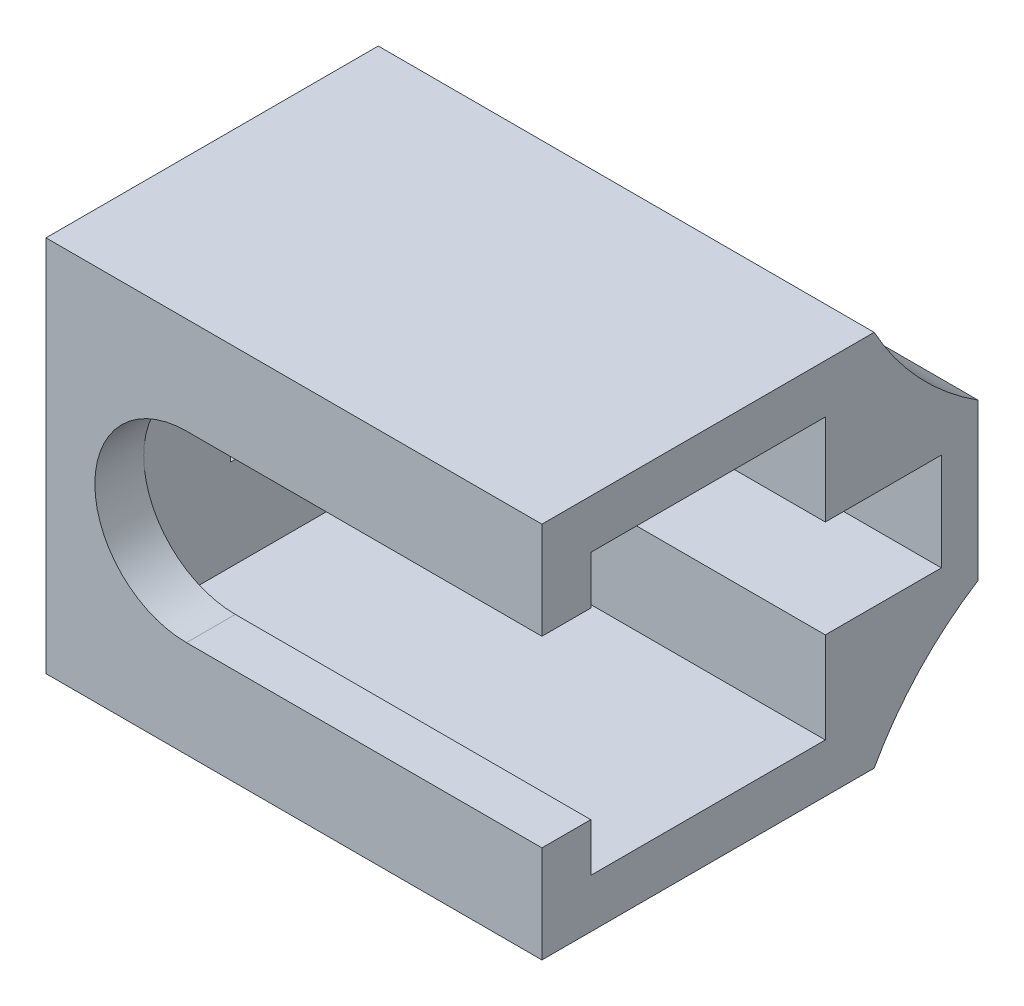
from build123d import *

# Parameters (mm, degrees)
SKETCH1_W               = 115
SKETCH1_H               = 90
BOSS_EXTRUDE1_DEPTH     = 2.5
SKETCH2_W               = 27.2
SKETCH2_H               = 30.9
SKETCH2_W_2             = 19.2
SKETCH2_H_2             = 22.9
BOSS_EXTRUDE2_DEPTH     = 40.6
SKETCH3_W               = 19.2
SKETCH3_H               = 22.9
BOSS_EXTRUDE3_DEPTH     = 4
CUT_EXTRUDE1_REACH      = 136.592
SKETCH4_W               = 5
SKETCH4_H               = 8
FILLET1_R               = 25
SKETCH5_W               = 38.2
SKETCH5_H               = 8
CUT_EXTRUDE2_DEPTH      = 39.6
CUT_EXTRUDE3_REACH      = 92.993
SKETCH6_W               = 20
SKETCH6_H               = 9.5
CUT_EXTRUDE4_REACH      = 129.903
CUT_EXTRUDE5_DEPTH      = 135.591762378
CUT_EXTRUDE5_DEPTH_BACK = 135.591762378
SKETCH9_W               = 100.7
SKETCH9_H               = 30.9
CUT_EXTRUDE6_REACH      = 92.993


# Read off the part's stored shape, not the designer's step: Mirror1
with BuildPart() as part:
    # Sketch1 → Boss-Extrude1 (new, symmetric)
    with BuildSketch(Plane(origin=(0, 0, 0), x_dir=(1, 0, 0), z_dir=(0, 1, 0))):
        Rectangle(SKETCH1_W, SKETCH1_H)
    extrude(amount=BOSS_EXTRUDE1_DEPTH, both=True)

    # Sketch2 → Boss-Extrude2 (add)
    with BuildSketch(Plane.ZY.offset(57.5)):
        with Locations((54.6, 0)):
            Rectangle(SKETCH2_W, SKETCH2_H)
        with Locations((54.6, 0)):
            Rectangle(SKETCH2_W_2, SKETCH2_H_2, mode=Mode.SUBTRACT)
    extrude(amount=-BOSS_EXTRUDE2_DEPTH)

    # Sketch3 → Boss-Extrude3 (add)
    with BuildSketch(Plane.ZY.offset(57.5)):
        with Locations((54.6, 0)):
            Rectangle(SKETCH3_W, SKETCH3_H)
    extrude(amount=-BOSS_EXTRUDE3_DEPTH)

    # Sketch4 → Cut-Extrude1 (cut, up to next)
    with BuildSketch(Plane.ZY.offset(57.5), mode=Mode.PRIVATE) as cut_extrude1_sk1:
        with Locations((54.6, 0)):
            Rectangle(SKETCH4_W, SKETCH4_H)
    cut_extrude1_tool1 = extrude(cut_extrude1_sk1.sketch, amount=-CUT_EXTRUDE1_REACH, mode=Mode.PRIVATE) & part.part
    add(cut_extrude1_tool1.solids().sort_by_distance((-57.5, 0, 54.6))[0], mode=Mode.SUBTRACT)

    # Fillet1
    # the kernel refuses this fillet: 25 mm, written as the material it adds along each edge
    with BuildSketch(Plane(origin=(-57.5, -2.5, 41), x_dir=(0, 0, -1), z_dir=(1, 0, 0))) as fillet1_piece_1:
        with BuildLine():
            CenterArc((21.904280404, -25), FILLET1_R, 90, 61.183893167)
            Line((0, -12.95), (-0.438085608, -12.709))
            ThreePointArc((-0.438085608, -12.709), (-0.5, -6.475), (-0.5, 0))
            Line((-0.5, 0), (0, 0.5))
            Line((0, 0.5), (21.904280404, 0.5))
            Line((21.904280404, 0.5), (21.904280404, 0))
        make_face()
    extrude(amount=40.6)
    with BuildSketch(Plane(origin=(-57.5, 2.5, 41), x_dir=(0, 0, -1), z_dir=(1, 0, 0))) as fillet1_piece_2:
        with BuildLine():
            CenterArc((21.904280404, 25), FILLET1_R, 208.816106833, 61.183893167)
            Line((0, 12.95), (-0.438085608, 12.709))
            ThreePointArc((-0.438085608, 12.709), (-0.5, 6.475), (-0.5, 0))
            Line((-0.5, 0), (0, -0.5))
            Line((0, -0.5), (21.904280404, -0.5))
            Line((21.904280404, -0.5), (21.904280404, 0))
        make_face()
    extrude(amount=40.6)

    # Sketch5 → Cut-Extrude2 (cut)
    with BuildSketch(Plane(origin=(-8.9, 0, 0), x_dir=(0, 0, -1), z_dir=(1, 0, 0))):
        with Locations((-54.6, 0)):
            Rectangle(SKETCH5_W, SKETCH5_H)
    extrude(amount=-CUT_EXTRUDE2_DEPTH, mode=Mode.SUBTRACT)

    # Sketch6 → Cut-Extrude3 (cut, up to next)
    with BuildSketch(Plane(origin=(0, 2.5, 0), x_dir=(1, 0, 0), z_dir=(0, 1, 0)), mode=Mode.PRIVATE) as cut_extrude3_sk1:
        with Locations((1.1, -40.25)):
            Rectangle(SKETCH6_W, SKETCH6_H)
    cut_extrude3_tool1 = extrude(cut_extrude3_sk1.sketch, amount=-CUT_EXTRUDE3_REACH, mode=Mode.PRIVATE) & part.part
    add(cut_extrude3_tool1.solids().sort_by_distance((1.1, 2.5, 40.25))[0], mode=Mode.SUBTRACT)

    # Sketch8 → Cut-Extrude4 (cut, up to next)
    with BuildSketch(Plane.XY.offset(68.2), mode=Mode.PRIVATE) as cut_extrude4_sk1:
        with BuildLine():
            Line((-46, 7.5), (-16, 7.5))
            ThreePointArc((-16, 7.5), (-8.5, 0), (-16, -7.5))
            Line((-16, -7.5), (-46, -7.5))
            ThreePointArc((-46, -7.5), (-53.5, 0), (-46, 7.5))
        make_face()
    cut_extrude4_tool1 = extrude(cut_extrude4_sk1.sketch, amount=-CUT_EXTRUDE4_REACH, mode=Mode.PRIVATE) & part.part
    add(cut_extrude4_tool1.solids().sort_by_distance((-31, 0, 68.2))[0], mode=Mode.SUBTRACT)

    # Mirror1
    split(bisect_by=Plane.XY, keep=Keep.TOP)

    # Mirror1 2: part across plane


with BuildPart() as part_1:
    add(part.part)
    add(part.part.mirror(Plane.XY))

    # Sketch9 → Cut-Extrude5 (cut, two sides: drawn at the far end of the back side and taken through both)
    with BuildSketch(Plane(origin=(57.5, 0, 0), x_dir=(0, 0, -1), z_dir=(1, 0, 0)).offset(-CUT_EXTRUDE5_DEPTH_BACK)):
        with Locations((17.85, 0)):
            Rectangle(SKETCH9_W, SKETCH9_H)
    extrude(amount=CUT_EXTRUDE5_DEPTH + CUT_EXTRUDE5_DEPTH_BACK, mode=Mode.SUBTRACT)

    # Sketch10 → Cut-Extrude6 (cut, up to next)
    with BuildSketch(Plane(origin=(0, 2.5, 0), x_dir=(1, 0, 0), z_dir=(0, 1, 0)), mode=Mode.PRIVATE) as cut_extrude6_sk1:
        Polygon((57.5, -32.5), (-16.9, -32.5), (-16.9, -35.5), (11.1, -35.5), (11.1, -45), (57.5, -45), align=None)
    cut_extrude6_tool1 = extrude(cut_extrude6_sk1.sketch, amount=-CUT_EXTRUDE6_REACH, mode=Mode.PRIVATE) & part_1.part
    add(cut_extrude6_tool1.solids().sort_by_distance((29.593976, 2.5, 38.149096))[0], mode=Mode.SUBTRACT)


solid = part_1.part
